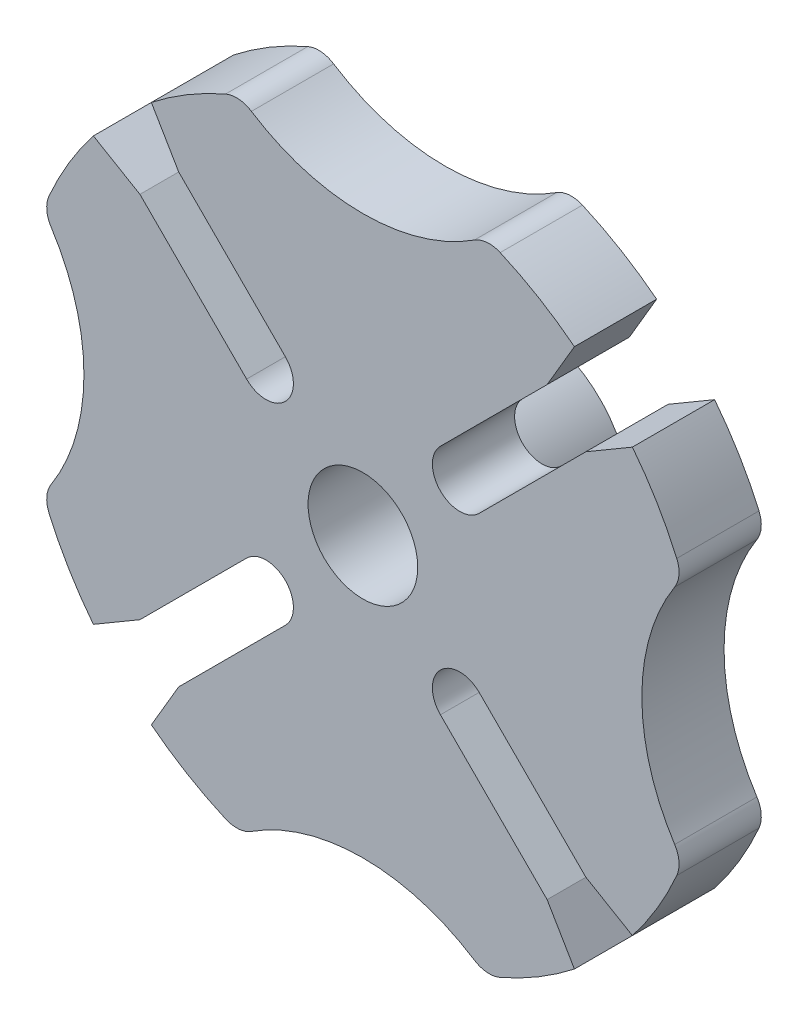
from build123d import *

# Parameters (mm, degrees)
SKETCH1_R           = 50
SKETCH1_R_2         = 4
BOSS_EXTRUDE1_DEPTH = 12
SKETCH2_R           = 30
CUT_EXTRUDE1_DEPTH  = 72.721684308
CUT_EXTRUDE2_DEPTH  = 72.721684308
CHAMFER1_SIZE       = 7.819775181
CIRPATTERN1_DEPTH   = 12
FILLET1_R           = 4
BOSS_EXTRUDE2_START = 12
SKETCH4_R           = 4
BOSS_EXTRUDE2_DEPTH = 12
SKETCH5_R           = 8
CUT_EXTRUDE3_DEPTH  = 12


with BuildPart() as part:
    # Sketch1 → Boss-Extrude1 (new body)
    with BuildSketch(Plane.XY):
        Circle(SKETCH1_R)
        Circle(SKETCH1_R_2, mode=Mode.SUBTRACT)
    extrude(amount=BOSS_EXTRUDE1_DEPTH)

    # Sketch2 → Cut-Extrude1 (cut, through all)
    with BuildSketch(Plane.XY.offset(12)):
        with Locations((-70.710678119, 0)):
            Circle(SKETCH2_R)
    extrude(amount=-CUT_EXTRUDE1_DEPTH, mode=Mode.SUBTRACT)

    # Sketch3 → Cut-Extrude2 (cut, through all)
    with BuildSketch(Plane.XY.offset(12)):
        with BuildLine():
            Line((-32.526911935, 38.183766184), (-11.313708499, 16.970562748))
            ThreePointArc((-11.313708499, 16.970562748), (-11.313708499, 11.313708499), (-16.970562748, 11.313708499))
            Line((-16.970562748, 11.313708499), (-38.183766184, 32.526911935))
            ThreePointArc((-38.183766184, 32.526911935), (-38.183766184, 38.183766184), (-32.526911935, 38.183766184))
        make_face()
    extrude(amount=-CUT_EXTRUDE2_DEPTH, mode=Mode.SUBTRACT)

    # Chamfer1
    # the kernel refuses this chamfer: 7.819775181, 2 mm, written as the material it takes off along each edge
    with BuildSketch(Plane(origin=(-38.070447498, 32.413593249, 32.307159288), x_dir=(-0.6329652069887249, -0.7741802417665543, 0), z_dir=(0, 0, -1))) as chamfer1_piece_1:
        with BuildLine():
            Line((1.993389554, 0), (CHAMFER1_SIZE * 0.0998541086907, -CHAMFER1_SIZE * 0.995002088869))
            Line((CHAMFER1_SIZE * 0.0998541086907, -CHAMFER1_SIZE * 0.995002088869), (0, 0))
            ThreePointArc((0, 0), (1.020707521, 0.009929226), (1.993389554, 0))
        make_face()
    extrude(amount=52.614318575, mode=Mode.SUBTRACT)
    with BuildSketch(Plane(origin=(-32.413593249, 38.070447498, 32.307159288), x_dir=(0.7741802417665462, 0.6329652069887348, 0), z_dir=(0, 0, -1))) as chamfer1_piece_2:
        with BuildLine():
            Line((1.993389554, 0), (CHAMFER1_SIZE * 0.0998541086907, CHAMFER1_SIZE * 0.995002088869))
            Line((CHAMFER1_SIZE * 0.0998541086907, CHAMFER1_SIZE * 0.995002088869), (0, 0))
            ThreePointArc((0, 0), (1.020707521, -0.009929226), (1.993389554, 0))
        make_face()
    extrude(amount=52.614318575, mode=Mode.SUBTRACT)

    # CirPattern1: read off the stored shape, not the designer's step
    # CirPattern1 outline → CirPattern1 (cut)
    with BuildSketch(Plane.XY):
        with BuildLine():
            Line((39.33219373, -30.870350442), (32.541031441, -26.884177191))
            Line((32.541031441, -26.884177191), (16.970562748, -11.313708499))
            ThreePointArc((16.970562748, -11.313708499), (11.313708499, -11.313708499), (11.313708499, -16.970562748))
            Line((11.313708499, -16.970562748), (26.884177191, -32.541031441))
            Line((26.884177191, -32.541031441), (30.870350442, -39.33219373))
            ThreePointArc((30.870350442, -39.33219373), (35.355339059, -35.355339059), (39.33219373, -30.870350442))
        make_face()
        with BuildLine():
            ThreePointArc((-17.944358445, 46.669047558), (0, 40.710678119), (17.944358445, 46.669047558))
            ThreePointArc((17.944358445, 46.669047558), (0, 50), (-17.944358445, 46.669047558))
        make_face()
        with BuildLine():
            Line((32.541031441, 26.884177191), (39.33219373, 30.870350442))
            ThreePointArc((39.33219373, 30.870350442), (35.35533906, 35.35533906), (30.870350442, 39.33219373))
            Line((30.870350442, 39.33219373), (26.884177191, 32.541031441))
            Line((26.884177191, 32.541031441), (11.313708499, 16.970562748))
            ThreePointArc((11.313708499, 16.970562748), (11.313708499, 11.313708499), (16.970562748, 11.313708499))
            Line((16.970562748, 11.313708499), (32.541031441, 26.884177191))
        make_face()
        with BuildLine():
            ThreePointArc((46.669047558, 17.944358445), (40.710678119, 0), (46.669047558, -17.944358445))
            ThreePointArc((46.669047558, -17.944358445), (50, 0), (46.669047558, 17.944358445))
        make_face()
        with BuildLine():
            ThreePointArc((-39.33219373, -30.870350442), (-35.355339059, -35.355339059), (-30.870350442, -39.332193729))
            Line((-30.870350442, -39.332193729), (-26.884177191, -32.541031441))
            Line((-26.884177191, -32.541031441), (-11.313708499, -16.970562748))
            ThreePointArc((-11.313708499, -16.970562748), (-11.313708499, -11.313708499), (-16.970562748, -11.313708499))
            Line((-16.970562748, -11.313708499), (-32.541031441, -26.884177191))
            Line((-32.541031441, -26.884177191), (-39.33219373, -30.870350442))
        make_face()
        with BuildLine():
            ThreePointArc((-17.944358445, -46.669047558), (0, -50), (17.944358445, -46.669047558))
            ThreePointArc((17.944358445, -46.669047558), (0, -40.710678119), (-17.944358445, -46.669047558))
        make_face()
    extrude(amount=CIRPATTERN1_DEPTH, mode=Mode.SUBTRACT)

    # Fillet1
    fillet1_edges = [part.edges().sort_by_distance(p)[0] for p in [
        (-46.669047558, -17.944358445, 6),
        (-46.669047558, 17.944358445, 6),
        (17.944358445, 46.669047558, 6),
        (-17.944358445, 46.669047558, 6),
        (46.669047558, -17.944358445, 6),
        (46.669047558, 17.944358445, 6),
        (-17.944358445, -46.669047558, 6),
        (17.944358445, -46.669047558, 6),
    ]]
    fillet(fillet1_edges, radius=FILLET1_R)

    # Sketch4 → Boss-Extrude2 (add)
    with BuildSketch(Plane(origin=(0, 0, 0), x_dir=(-1, 0, 0), z_dir=(0, 0, -1)).offset(BOSS_EXTRUDE2_START)):
        with BuildLine():
            Line((12.990381057, -7.5), (8.660254038, -15))
            ThreePointArc((8.660254038, -15), (0, -20), (-8.660254038, -15))
            Line((-8.660254038, -15), (-12.990381057, -7.5))
            ThreePointArc((-12.990381057, -7.5), (0, 15), (12.990381057, -7.5))
        make_face()
        Circle(SKETCH4_R, mode=Mode.SUBTRACT)
    extrude(amount=-BOSS_EXTRUDE2_DEPTH)

    # Sketch5 → Cut-Extrude3 (cut)
    with BuildSketch(Plane.XY.offset(12)):
        Circle(SKETCH5_R)
    extrude(amount=-CUT_EXTRUDE3_DEPTH, mode=Mode.SUBTRACT)


solid = part.part
